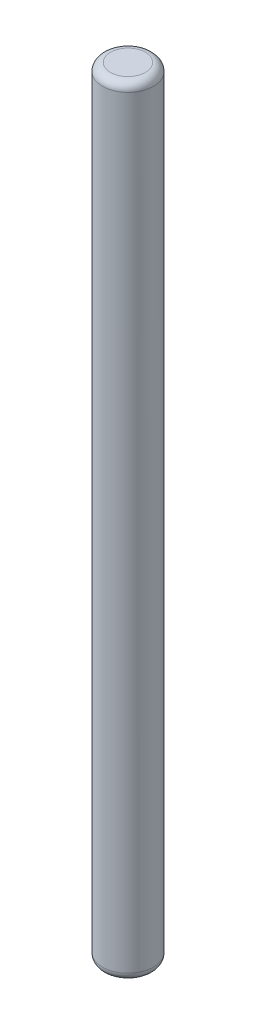
from build123d import *

# Parameters (mm, degrees)
SKETCH1_R               = 3.175
BOSS_EXTRUDE1_DEPTH     = 97
CUT_EXTRUDE1_DEPTH      = 98.103868358
CUT_EXTRUDE1_DEPTH_BACK = 21


with BuildPart() as part:
    # Sketch1 → Boss-Extrude1 (new body)
    with BuildSketch(Plane(origin=(0, 0, 0), x_dir=(1, 0, 0), z_dir=(0, 1, 0))):
        with Locations(Location((0, 0, 0), (0, 0, 90))):
            Circle(SKETCH1_R)
    extrude(amount=BOSS_EXTRUDE1_DEPTH)

    # Sketch2 → Cut-Extrude1 (cut, two sides: drawn at the far end of the back side and taken through both)
    with BuildSketch(Plane(origin=(0, 97, 0), x_dir=(1, 0, 0), z_dir=(0, 1, 0)).offset(-CUT_EXTRUDE1_DEPTH_BACK)):
        Polygon((-26.82080565, 2.517016971), (-1.610698227, 2.736106032), (1.562902146, 2.763686285), (26.773009569, 2.982775346), (26.334831446, 53.402990191), (-27.258983772, 52.937231816), align=None)
    extrude(amount=CUT_EXTRUDE1_DEPTH + CUT_EXTRUDE1_DEPTH_BACK, mode=Mode.SUBTRACT)

    # Fillet1: read off the stored shape, not the designer's step
    # Fillet1 outline → Fillet1 (revolve, cut)
    with BuildSketch(Plane.XY):
        with BuildLine():
            ThreePointArc((3.175, 1), (2.882106781, 0.292893219), (2.175, 0))
            Line((2.175, 0), (3.175, 0))
            Line((3.175, 0), (3.175, 1))
        make_face()
        with BuildLine():
            ThreePointArc((2.175, 97), (2.882106781, 96.707106781), (3.175, 96))
            Line((3.175, 96), (3.175, 97))
            Line((3.175, 97), (2.175, 97))
        make_face()
    revolve(axis=Axis((0, 0, 0), (0, 1, 0)), mode=Mode.SUBTRACT)


solid = part.part
